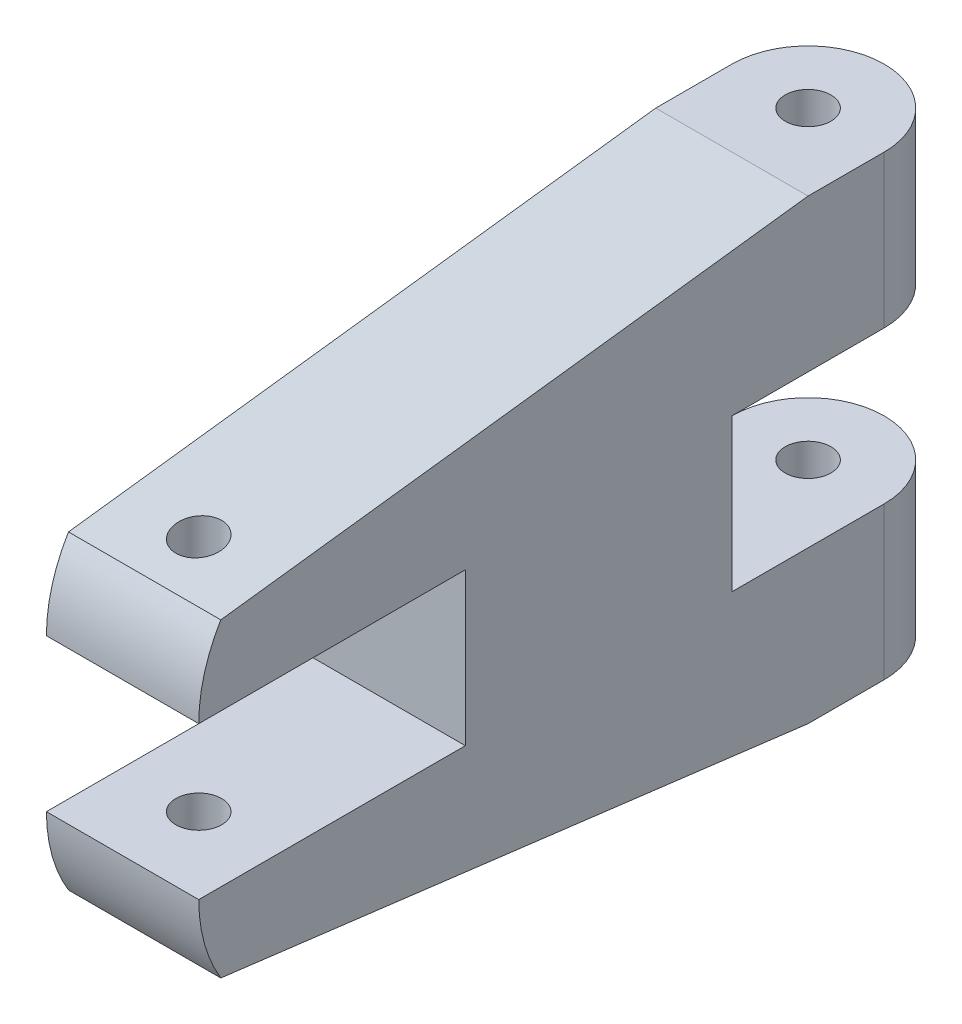
from build123d import *

# Parameters (mm, degrees)
SALIENTE_EXTRUIR1_DEPTH = 10
REDONDEO4_R             = 10
CROQUIS2_R              = 1.5
CORTAR_EXTRUIR1_DEPTH   = 24
CROQUIS3_W              = 15
CROQUIS3_H              = 10
CORTAR_EXTRUIR2_DEPTH   = 48
REDONDEO6_R             = 5
CORTAR_EXTRUIR3_DEPTH   = 10


with BuildPart() as part:
    # Croquis1 → Saliente-Extruir1 (new body)
    with BuildSketch(Plane(origin=(0, 0, 0), x_dir=(0, 0, -1), z_dir=(1, 0, 0))):
        Polygon((-7.5, 5), (-7.5, -5), (-25, -5), (-25, -15), (25, -15), (25, -5), (25, 5), (25, 15), (-25, 15), (-25, 5), align=None)
    extrude(amount=SALIENTE_EXTRUIR1_DEPTH)

    # Redondeo4
    redondeo4_edges = [part.edges().sort_by_distance(p)[0] for p in [
        (5, 15, 25),
        (5, -15, 25),
    ]]
    fillet(redondeo4_edges, radius=REDONDEO4_R - 0.0001)  # a hair under: the kernel refuses the full size

    # Croquis2 → Cortar-Extruir1 (cut, symmetric)
    with BuildSketch(Plane.XZ.offset(-5)):
        with Locations(Location((5, 20, 0), (0, 0, 270))):
            Circle(CROQUIS2_R)
        with Locations(Location((5, -20, 0), (0, 0, 270))):
            Circle(CROQUIS2_R)
    extrude(amount=CORTAR_EXTRUIR1_DEPTH, both=True, mode=Mode.SUBTRACT)

    # Croquis3 → Cortar-Extruir2 (cut)
    with BuildSketch(Plane(origin=(10, 0, 0), x_dir=(0, 0, -1), z_dir=(1, 0, 0))):
        with Locations((17.5, 0)):
            Rectangle(CROQUIS3_W, CROQUIS3_H)
    extrude(amount=-CORTAR_EXTRUIR2_DEPTH, mode=Mode.SUBTRACT)

    # Redondeo6
    redondeo6_edges = [part.edges().sort_by_distance(p)[0] for p in [
        (10, 10, -25),
        (0, 10, -25),
        (10, -10, -25),
        (0, -10, -25),
    ]]
    fillet(redondeo6_edges, radius=REDONDEO6_R - 0.0001)  # a hair under: the kernel refuses the full size

    # Croquis4 → Cortar-Extruir3 (cut)
    with BuildSketch(Plane(origin=(10, 0, 0), x_dir=(0, 0, -1), z_dir=(1, 0, 0))):
        Polygon((-25, 10), (15, 15), (-25, 17.816893643), align=None)
        Polygon((-25, -10), (15, -15), (-25, -17.816893643), align=None)
    extrude(amount=-CORTAR_EXTRUIR3_DEPTH, mode=Mode.SUBTRACT)


solid = part.part
